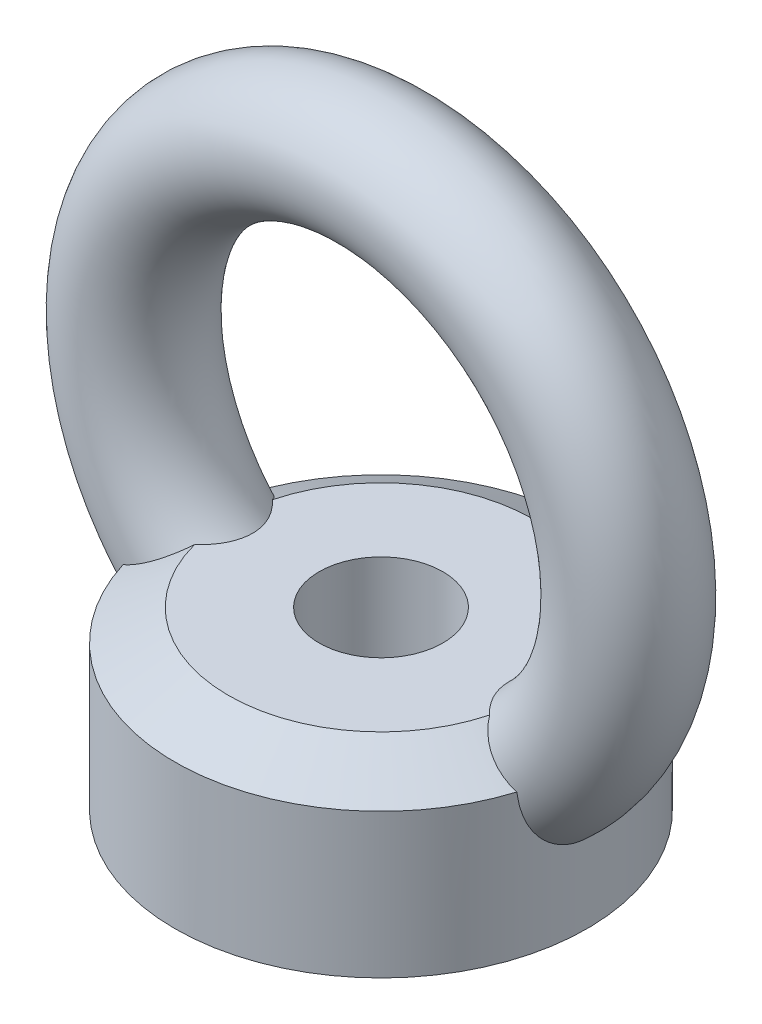
from build123d import *

# Parameters (mm, degrees)
SKETCH4_R           = 3
SKETCH5_R           = 10
BOSS_EXTRUDE2_DEPTH = 8.5
CHAMFER1_SIZE2      = 2.598076211
CHAMFER1_SIZE       = 1.5
SKETCH6_R           = 3
CUT_EXTRUDE1_DEPTH  = 8.5


with BuildPart() as part:
    # Sketch4 → Revolve2 (revolve)
    with BuildSketch(Plane(origin=(0, 0, 0), x_dir=(1, 0, 0), z_dir=(0, 1, 0))):
        with Locations((12, 0)):
            Circle(SKETCH4_R)
    revolve(axis=Axis((0, 0, 4.721857772), (0, 0, -1)))

    # Sketch5 → Boss-Extrude2 (add)
    with BuildSketch(Plane(origin=(0, -15, 0), x_dir=(1, 0, 0), z_dir=(0, 1, 0))):
        Circle(SKETCH5_R)
    extrude(amount=BOSS_EXTRUDE2_DEPTH)

    # Chamfer1
    chamfer1_edges = [part.edges().sort_by_distance(p)[0] for p in [
        (0, -6.5, -10),
        (0, -6.5, 10),
    ]]
    chamfer(chamfer1_edges, length=CHAMFER1_SIZE, length2=CHAMFER1_SIZE2)

    # Sketch6 → Cut-Extrude1 (cut)
    with BuildSketch(Plane.XZ.offset(15)):
        Circle(SKETCH6_R)
    extrude(amount=-CUT_EXTRUDE1_DEPTH, mode=Mode.SUBTRACT)


solid = part.part
